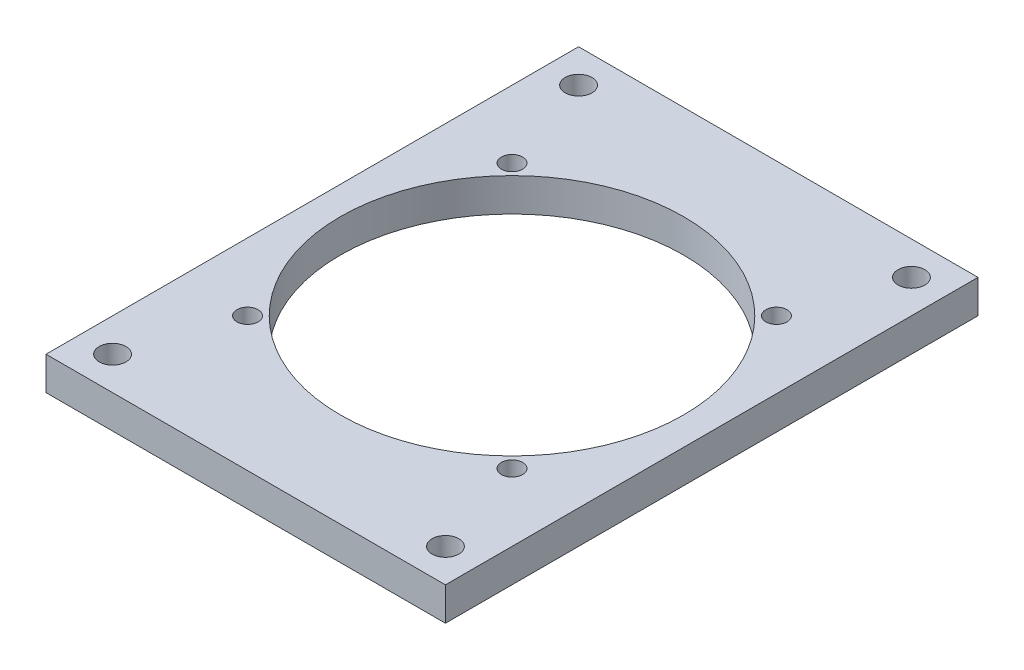
from build123d import *

# Parameters (mm, degrees)
STOCK_GEARBOX_START                           = 12.7
STOCK_GEARBOX_WHEEL_PROTOTYPE_STRUCT_2_W      = 76.2
STOCK_GEARBOX_WHEEL_PROTOTYPE_STRUCT_2_H      = 101.6
STOCK_GEARBOX_WHEEL_PROTOTYPE_STRUCT_2_R      = 2.5527
STOCK_GEARBOX_WHEEL_PROTOTYPE_STRUCT_2_R_2    = 2.0193
STOCK_GEARBOX_WHEEL_PROTOTYPE_STRUCT_2_R_3    = 32.5
STOCK_GEARBOX_WHEEL_PROTOTYPE_STRUCTURE_DEPTH = 6.35
SKETCH1_R                                     = 32.754
CUT_EXTRUDE1_DEPTH                            = 64.816710194


# Read off the part's stored shape, not the designer's step: Stock-Gearbox Wheel Prototype Structure-1
with BuildPart() as part:
    # Stock-Gearbox Wheel Prototype Struct 2 → Stock-Gearbox Wheel Prototype Structure-1 (new body)
    with BuildSketch(Plane(origin=(0, 0, 0), x_dir=(1, 0, 0), z_dir=(0, 1, 0)).offset(STOCK_GEARBOX_START)):
        Rectangle(STOCK_GEARBOX_WHEEL_PROTOTYPE_STRUCT_2_W, STOCK_GEARBOX_WHEEL_PROTOTYPE_STRUCT_2_H)
        with Locations((-31.75, -44.45)):
            Circle(STOCK_GEARBOX_WHEEL_PROTOTYPE_STRUCT_2_R, mode=Mode.SUBTRACT)
        with Locations((-25.226034419, -25.226034419)):
            Circle(STOCK_GEARBOX_WHEEL_PROTOTYPE_STRUCT_2_R_2, mode=Mode.SUBTRACT)
        with Locations((31.75, -44.45)):
            Circle(STOCK_GEARBOX_WHEEL_PROTOTYPE_STRUCT_2_R, mode=Mode.SUBTRACT)
        Circle(STOCK_GEARBOX_WHEEL_PROTOTYPE_STRUCT_2_R_3, mode=Mode.SUBTRACT)
        with Locations((25.226034419, -25.226034419)):
            Circle(STOCK_GEARBOX_WHEEL_PROTOTYPE_STRUCT_2_R_2, mode=Mode.SUBTRACT)
        with Locations((-25.226034419, 25.226034419)):
            Circle(STOCK_GEARBOX_WHEEL_PROTOTYPE_STRUCT_2_R_2, mode=Mode.SUBTRACT)
        with Locations((-31.75, 44.45)):
            Circle(STOCK_GEARBOX_WHEEL_PROTOTYPE_STRUCT_2_R, mode=Mode.SUBTRACT)
        with Locations((25.226034419, 25.226034419)):
            Circle(STOCK_GEARBOX_WHEEL_PROTOTYPE_STRUCT_2_R_2, mode=Mode.SUBTRACT)
        with Locations((31.75, 44.45)):
            Circle(STOCK_GEARBOX_WHEEL_PROTOTYPE_STRUCT_2_R, mode=Mode.SUBTRACT)
    extrude(amount=STOCK_GEARBOX_WHEEL_PROTOTYPE_STRUCTURE_DEPTH)

    # Sketch1 → Cut-Extrude1 (cut, through all)
    with BuildSketch(Plane(origin=(0, 19.05, 0), x_dir=(1, 0, 0), z_dir=(0, 1, 0))):
        with Locations(Location((0, 0, 0), (0, 0, 270))):
            Circle(SKETCH1_R)
    extrude(amount=-CUT_EXTRUDE1_DEPTH, mode=Mode.SUBTRACT)


solid = part.part
